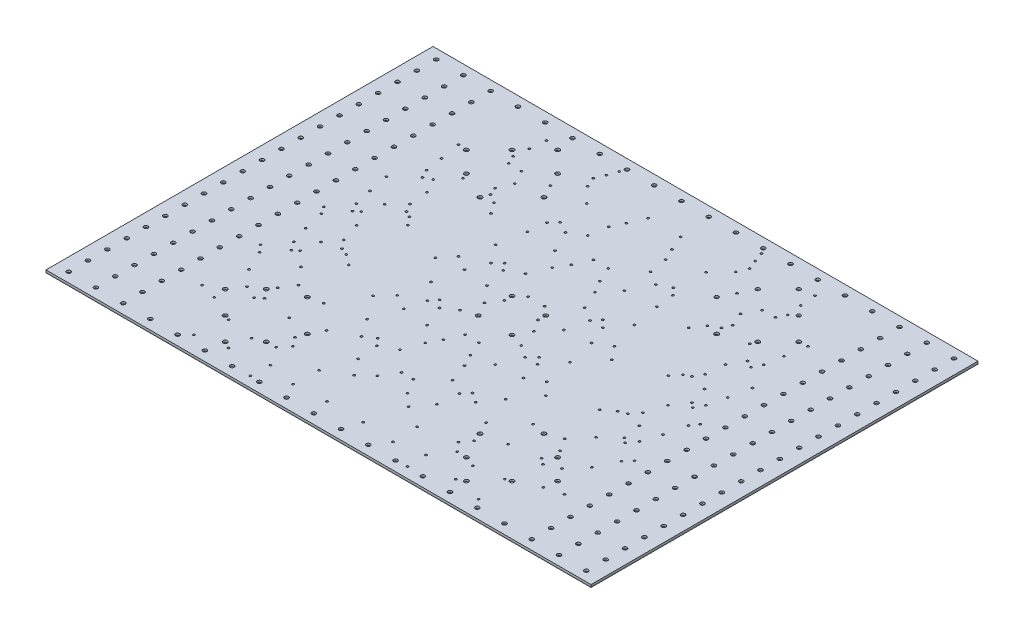
from build123d import *

# Parameters (mm, degrees)
SKETCH2_W                   = 845
SKETCH2_H                   = 600
SKETCH2_R                   = 3.3
SKETCH2_R_2                 = 3.25
SKETCH2_R_3                 = 3
BOSS_EXTRUDE2_DEPTH         = 3
ESQUISSE6_W                 = 845
ESQUISSE6_H                 = 600
ESQUISSE6_R                 = 3.25
BOSS_EXTRU_3_DEPTH          = 1
ESQUISSE5_W                 = 845
ESQUISSE5_H                 = 600
BOSS_EXTRU_2_DEPTH          = 1
ESQUISSE4_R                 = 1.6
ENL_V_MAT_EXTRU_2_DEPTH     = 10
R_P_T_START                 = 1310.548413309
R_P_T_PAR_COURBE2_OUTLINE_R = 1.6
R_P_T_PAR_COURBE2_DEPTH     = 3
SKETCH5_R                   = 3.15
CUT_EXTRUDE1_DEPTH          = 10


# Read off the part's stored shape, not the designer's step: Répét. par courbe2
with BuildPart() as part:
    # Sketch2 → Boss-Extrude2 (new body)
    with BuildSketch(Plane(origin=(0, 1310.548413309, 0), x_dir=(1, 0, 0), z_dir=(0, 1, 0))):
        with Locations((1065.777273447, -1504.227226955)):
            Rectangle(SKETCH2_W, SKETCH2_H)
        with Locations(Location((843.462901442, -1726.54159896, 0), (0, 0, 180))):
            Circle(SKETCH2_R, mode=Mode.SUBTRACT)
        with Locations(Location((878.818240502, -1761.896938019, 0), (0, 0, 180))):
            Circle(SKETCH2_R, mode=Mode.SUBTRACT)
        with Locations(Location((910.638045655, -1730.077132866, 0), (0, 0, 180))):
            Circle(SKETCH2_R, mode=Mode.SUBTRACT)
        with Locations(Location((808.107562383, -1691.186259901, 0), (0, 0, 180))):
            Circle(SKETCH2_R, mode=Mode.SUBTRACT)
        with Locations(Location((839.927367536, -1659.366454747, 0), (0, 0, 180))):
            Circle(SKETCH2_R, mode=Mode.SUBTRACT)
        with Locations(Location((931.851249091, -1687.650725995, 0), (0, 0, 180))):
            Circle(SKETCH2_R, mode=Mode.SUBTRACT)
        with Locations(Location((882.353774408, -1638.153251312, 0), (0, 0, 180))):
            Circle(SKETCH2_R, mode=Mode.SUBTRACT)
        with Locations(Location((1039.614322544, -1530.390177859, 0), (0, 0, 180))):
            Circle(SKETCH2_R_2, mode=Mode.SUBTRACT)
        with Locations(Location((1252.736306393, -1761.896938019, 0), (0, 0, 180))):
            Circle(SKETCH2_R, mode=Mode.SUBTRACT)
        with Locations(Location((1220.91650124, -1730.077132866, 0), (0, 0, 180))):
            Circle(SKETCH2_R, mode=Mode.SUBTRACT)
        with Locations(Location((1288.091645453, -1726.54159896, 0), (0, 0, 180))):
            Circle(SKETCH2_R, mode=Mode.SUBTRACT)
        with Locations(Location((1199.703297804, -1687.650725995, 0), (0, 0, 180))):
            Circle(SKETCH2_R, mode=Mode.SUBTRACT)
        with Locations(Location((1249.200772487, -1638.153251312, 0), (0, 0, 180))):
            Circle(SKETCH2_R, mode=Mode.SUBTRACT)
        with Locations(Location((1323.446984512, -1691.186259901, 0), (0, 0, 180))):
            Circle(SKETCH2_R, mode=Mode.SUBTRACT)
        with Locations(Location((1291.627179358, -1659.366454747, 0), (0, 0, 180))):
            Circle(SKETCH2_R, mode=Mode.SUBTRACT)
        with Locations(Location((1091.940224351, -1530.390177859, 0), (0, 0, 180))):
            Circle(SKETCH2_R_2, mode=Mode.SUBTRACT)
        with Locations(Location((1039.614322544, -1478.064276051, 0), (0, 0, 180))):
            Circle(SKETCH2_R_2, mode=Mode.SUBTRACT)
        with Locations(Location((839.927367536, -1349.087999163, 0), (0, 0, 180))):
            Circle(SKETCH2_R, mode=Mode.SUBTRACT)
        with Locations(Location((808.107562383, -1317.268194009, 0), (0, 0, 180))):
            Circle(SKETCH2_R, mode=Mode.SUBTRACT)
        with Locations(Location((882.353774408, -1370.301202598, 0), (0, 0, 180))):
            Circle(SKETCH2_R, mode=Mode.SUBTRACT)
        with Locations(Location((931.851249091, -1320.803727915, 0), (0, 0, 180))):
            Circle(SKETCH2_R, mode=Mode.SUBTRACT)
        with Locations(Location((843.462901442, -1281.91285495, 0), (0, 0, 180))):
            Circle(SKETCH2_R, mode=Mode.SUBTRACT)
        with Locations(Location((910.638045655, -1278.377321044, 0), (0, 0, 180))):
            Circle(SKETCH2_R, mode=Mode.SUBTRACT)
        with Locations(Location((878.818240502, -1246.55751589, 0), (0, 0, 180))):
            Circle(SKETCH2_R, mode=Mode.SUBTRACT)
        with Locations(Location((1091.940224351, -1478.064276051, 0), (0, 0, 180))):
            Circle(SKETCH2_R_2, mode=Mode.SUBTRACT)
        with Locations(Location((1249.200772487, -1370.301202598, 0), (0, 0, 180))):
            Circle(SKETCH2_R, mode=Mode.SUBTRACT)
        with Locations(Location((1291.627179359, -1349.087999162, 0), (0, 0, 180))):
            Circle(SKETCH2_R, mode=Mode.SUBTRACT)
        with Locations(Location((1323.446984512, -1317.268194009, 0), (0, 0, 180))):
            Circle(SKETCH2_R, mode=Mode.SUBTRACT)
        with Locations(Location((1220.91650124, -1278.377321044, 0), (0, 0, 180.000000001))):
            Circle(SKETCH2_R_3, mode=Mode.SUBTRACT)
        with Locations(Location((1252.736306393, -1246.55751589, 0), (0, 0, 180.000000001))):
            Circle(SKETCH2_R_3, mode=Mode.SUBTRACT)
        with Locations(Location((1288.091645453, -1281.91285495, 0), (0, 0, 180.000000001))):
            Circle(SKETCH2_R_3, mode=Mode.SUBTRACT)
        with Locations(Location((1199.703297804, -1320.803727915, 0), (0, 0, 180.000000001))):
            Circle(SKETCH2_R_3, mode=Mode.SUBTRACT)
    extrude(amount=BOSS_EXTRUDE2_DEPTH)

    # Esquisse4 → Enlèv. mat.-Extru.2 (cut)
    with BuildSketch(Plane(origin=(0, 1313.548413309, 0), x_dir=(1, 0, 0), z_dir=(0, 1, 0))):
        with Locations(Location((773.984163667, -1504.236041092, 0), (0, 0, 180))):
            Circle(ESQUISSE4_R)
    enl_v_mat_extru_2 = extrude(amount=-ENL_V_MAT_EXTRU_2_DEPTH, mode=Mode.SUBTRACT)

    # Répét. par courbe2 outline → Répét. par courbe2 (cut)
    with BuildSketch(Plane(origin=(0, 0, 0), x_dir=(1, 0, 0), z_dir=(0, 1, 0)).offset(R_P_T_START)):
        with Locations((1017.011835586, -1338.058263909)):
            Circle(R_P_T_PAR_COURBE2_OUTLINE_R)
        with Locations((1019.988290397, -1437.531154838)):
            Circle(R_P_T_PAR_COURBE2_OUTLINE_R)
        with Locations((1018.230755151, -1537.324923481)):
            Circle(R_P_T_PAR_COURBE2_OUTLINE_R)
        with Locations((1024.979290951, -1636.984700597)):
            Circle(R_P_T_PAR_COURBE2_OUTLINE_R)
        with Locations((989.799049704, -1727.342884034)):
            Circle(R_P_T_PAR_COURBE2_OUTLINE_R)
        with Locations((894.281195122, -1736.464787711)):
            Circle(R_P_T_PAR_COURBE2_OUTLINE_R)
        with Locations((821.581118835, -1670.932840524)):
            Circle(R_P_T_PAR_COURBE2_OUTLINE_R)
        with Locations((797.757202877, -1574.483875629)):
            Circle(R_P_T_PAR_COURBE2_OUTLINE_R)
        with Locations((794.853703778, -1474.558986203)):
            Circle(R_P_T_PAR_COURBE2_OUTLINE_R)
        with Locations((804.426723908, -1375.197221122)):
            Circle(R_P_T_PAR_COURBE2_OUTLINE_R)
        with Locations((852.841271173, -1289.683714442)):
            Circle(R_P_T_PAR_COURBE2_OUTLINE_R)
        with Locations((944.608883647, -1256.971523567)):
            Circle(R_P_T_PAR_COURBE2_OUTLINE_R)
        with Locations((1021.743712067, -1309.998834826)):
            Circle(R_P_T_PAR_COURBE2_OUTLINE_R)
        with Locations((1032.614618923, -1408.723603574)):
            Circle(R_P_T_PAR_COURBE2_OUTLINE_R)
        with Locations((1027.508784025, -1508.553725652)):
            Circle(R_P_T_PAR_COURBE2_OUTLINE_R)
        with Locations((1035.303345565, -1608.233590697)):
            Circle(R_P_T_PAR_COURBE2_OUTLINE_R)
        with Locations((814.395622483, -1581.338432932)):
            Circle(R_P_T_PAR_COURBE2_OUTLINE_R)
        with Locations((809.302465667, -1481.578071046)):
            Circle(R_P_T_PAR_COURBE2_OUTLINE_R)
        with Locations((822.024260202, -1382.72681922)):
            Circle(R_P_T_PAR_COURBE2_OUTLINE_R)
        with Locations((879.120373848, -1303.087734006)):
            Circle(R_P_T_PAR_COURBE2_OUTLINE_R)
        with Locations((973.344082806, -1295.830867584)):
            Circle(R_P_T_PAR_COURBE2_OUTLINE_R)
        with Locations((1011.998568594, -1383.697051441)):
            Circle(R_P_T_PAR_COURBE2_OUTLINE_R)
        with Locations((1006.141897741, -1483.463134836)):
            Circle(R_P_T_PAR_COURBE2_OUTLINE_R)
        with Locations((1012.901556622, -1583.106166187)):
            Circle(R_P_T_PAR_COURBE2_OUTLINE_R)
        with Locations((1004.784000485, -1681.799044288)):
            Circle(R_P_T_PAR_COURBE2_OUTLINE_R)
        with Locations((925.468262807, -1729.49586717)):
            Circle(R_P_T_PAR_COURBE2_OUTLINE_R)
        with Locations((841.836875587, -1680.088010796)):
            Circle(R_P_T_PAR_COURBE2_OUTLINE_R)
        with Locations((807.111279812, -1587.543060907)):
            Circle(R_P_T_PAR_COURBE2_OUTLINE_R)
        with Locations((801.975144401, -1487.757119695)):
            Circle(R_P_T_PAR_COURBE2_OUTLINE_R)
        with Locations((810.981349638, -1388.363564499)):
            Circle(R_P_T_PAR_COURBE2_OUTLINE_R)
        with Locations((859.004537327, -1302.509952379)):
            Circle(R_P_T_PAR_COURBE2_OUTLINE_R)
        with Locations((950.857781948, -1272.167321043)):
            Circle(R_P_T_PAR_COURBE2_OUTLINE_R)
        with Locations((810.598688291, -1710.723536429)):
            Circle(R_P_T_PAR_COURBE2_OUTLINE_R)
        with Locations((785.185497652, -1615.020632353)):
            Circle(R_P_T_PAR_COURBE2_OUTLINE_R)
        with Locations((781.192989955, -1515.127014876)):
            Circle(R_P_T_PAR_COURBE2_OUTLINE_R)
        with Locations((781.953560087, -1415.139573728)):
            Circle(R_P_T_PAR_COURBE2_OUTLINE_R)
        with Locations((794.853478653, -1316.22906532)):
            Circle(R_P_T_PAR_COURBE2_OUTLINE_R)
        with Locations((857.617508341, -1242.556325342)):
            Circle(R_P_T_PAR_COURBE2_OUTLINE_R)
        with Locations((955.631075645, -1227.683530603)):
            Circle(R_P_T_PAR_COURBE2_OUTLINE_R)
        with Locations((1040.550132416, -1267.963729694)):
            Circle(R_P_T_PAR_COURBE2_OUTLINE_R)
        with Locations((1054.265603444, -1366.399174999)):
            Circle(R_P_T_PAR_COURBE2_OUTLINE_R)
        with Locations((1052.939564152, -1466.378969333)):
            Circle(R_P_T_PAR_COURBE2_OUTLINE_R)
        with Locations((1055.112245474, -1566.324695173)):
            Circle(R_P_T_PAR_COURBE2_OUTLINE_R)
        with Locations((1056.685505477, -1666.290823961)):
            Circle(R_P_T_PAR_COURBE2_OUTLINE_R)
        with Locations((1037.857774403, -1762.990057959)):
            Circle(R_P_T_PAR_COURBE2_OUTLINE_R)
        with Locations((944.02016535, -1787.965350892)):
            Circle(R_P_T_PAR_COURBE2_OUTLINE_R)
        with Locations((845.108093676, -1776.79469851)):
            Circle(R_P_T_PAR_COURBE2_OUTLINE_R)
        with Locations((784.82453177, -1703.667931565)):
            Circle(R_P_T_PAR_COURBE2_OUTLINE_R)
        with Locations((1023.610923678, -1706.802721256)):
            Circle(R_P_T_PAR_COURBE2_OUTLINE_R)
        with Locations((945.112715244, -1758.143381188)):
            Circle(R_P_T_PAR_COURBE2_OUTLINE_R)
        with Locations((851.708005755, -1729.536350273)):
            Circle(R_P_T_PAR_COURBE2_OUTLINE_R)
        with Locations((800.002811332, -1646.237213175)):
            Circle(R_P_T_PAR_COURBE2_OUTLINE_R)
        with Locations((788.869457058, -1547.043097148)):
            Circle(R_P_T_PAR_COURBE2_OUTLINE_R)
        with Locations((788.426664215, -1447.063544953)):
            Circle(R_P_T_PAR_COURBE2_OUTLINE_R)
        with Locations((800.2918428, -1347.99801813)):
            Circle(R_P_T_PAR_COURBE2_OUTLINE_R)
        with Locations((855.297210637, -1266.91803556)):
            Circle(R_P_T_PAR_COURBE2_OUTLINE_R)
        with Locations((950.398303083, -1242.566233676)):
            Circle(R_P_T_PAR_COURBE2_OUTLINE_R)
        with Locations((1030.445086198, -1291.571759589)):
            Circle(R_P_T_PAR_COURBE2_OUTLINE_R)
        with Locations((1043.690013696, -1390.045794566)):
            Circle(R_P_T_PAR_COURBE2_OUTLINE_R)
        with Locations((1039.638768723, -1489.953732783)):
            Circle(R_P_T_PAR_COURBE2_OUTLINE_R)
        with Locations((1044.899385382, -1589.777518976)):
            Circle(R_P_T_PAR_COURBE2_OUTLINE_R)
        with Locations((1042.452852518, -1689.570425299)):
            Circle(R_P_T_PAR_COURBE2_OUTLINE_R)
        with Locations((988.346812624, -1766.197238313)):
            Circle(R_P_T_PAR_COURBE2_OUTLINE_R)
        with Locations((889.467822476, -1767.619527617)):
            Circle(R_P_T_PAR_COURBE2_OUTLINE_R)
        with Locations((900.4495298, -1366.749845931)):
            Circle(R_P_T_PAR_COURBE2_OUTLINE_R)
        with Locations((853.733608854, -1451.192041433)):
            Circle(R_P_T_PAR_COURBE2_OUTLINE_R)
        with Locations((855.337431356, -1550.812041458)):
            Circle(R_P_T_PAR_COURBE2_OUTLINE_R)
        with Locations((903.470157297, -1633.804696358)):
            Circle(R_P_T_PAR_COURBE2_OUTLINE_R)
        with Locations((949.859825549, -1566.135574545)):
            Circle(R_P_T_PAR_COURBE2_OUTLINE_R)
        with Locations((945.045066257, -1466.311636588)):
            Circle(R_P_T_PAR_COURBE2_OUTLINE_R)
        with Locations((912.442082716, -1383.524697839)):
            Circle(R_P_T_PAR_COURBE2_OUTLINE_R)
        with Locations((863.846616914, -1463.650748481)):
            Circle(R_P_T_PAR_COURBE2_OUTLINE_R)
        with Locations((965.419112376, -1379.946559833)):
            Circle(R_P_T_PAR_COURBE2_OUTLINE_R)
        with Locations((886.741570742, -1358.476062076)):
            Circle(R_P_T_PAR_COURBE2_OUTLINE_R)
        with Locations((844.367807668, -1446.450822434)):
            Circle(R_P_T_PAR_COURBE2_OUTLINE_R)
        with Locations((844.187531863, -1546.171841673)):
            Circle(R_P_T_PAR_COURBE2_OUTLINE_R)
        with BuildLine():
            ThreePointArc((879.436556205, -1636.61057897), (879.630603525, -1636.289293066), (879.859879273, -1635.992120346))
            ThreePointArc((879.859879273, -1635.992120346), (879.611495231, -1636.276213805), (879.436556205, -1636.61057897))
        make_face()
        with Locations((958.255110669, -1621.408896004)):
            Circle(R_P_T_PAR_COURBE2_OUTLINE_R)
        with Locations((958.034929344, -1521.959519157)):
            Circle(R_P_T_PAR_COURBE2_OUTLINE_R)
        with Locations((958.226858296, -1422.0237238)):
            Circle(R_P_T_PAR_COURBE2_OUTLINE_R)
        with Locations((871.308795234, -1562.84337327)):
            Circle(R_P_T_PAR_COURBE2_OUTLINE_R)
        with Locations((931.797713653, -1585.557591683)):
            Circle(R_P_T_PAR_COURBE2_OUTLINE_R)
        with Locations((929.032852504, -1486.220508039)):
            Circle(R_P_T_PAR_COURBE2_OUTLINE_R)
        with Locations((977.999717441, -1341.878982234)):
            Circle(R_P_T_PAR_COURBE2_OUTLINE_R)
        with Locations((989.64771797, -1439.558545258)):
            Circle(R_P_T_PAR_COURBE2_OUTLINE_R)
        with Locations((988.715775182, -1539.359671199)):
            Circle(R_P_T_PAR_COURBE2_OUTLINE_R)
        with Locations((992.319282029, -1638.961597282)):
            Circle(R_P_T_PAR_COURBE2_OUTLINE_R)
        with Locations((926.991988655, -1701.80135372)):
            Circle(R_P_T_PAR_COURBE2_OUTLINE_R)
        with Locations((846.860795363, -1648.670442722)):
            Circle(R_P_T_PAR_COURBE2_OUTLINE_R)
        with Locations((819.017650077, -1553.57986759)):
            Circle(R_P_T_PAR_COURBE2_OUTLINE_R)
        with Locations((817.860016543, -1453.679663748)):
            Circle(R_P_T_PAR_COURBE2_OUTLINE_R)
        with Locations((843.447282654, -1357.841122667)):
            Circle(R_P_T_PAR_COURBE2_OUTLINE_R)
        with Locations((921.04382105, -1300.042759721)):
            Circle(R_P_T_PAR_COURBE2_OUTLINE_R)
        with Locations((995.791450252, -1351.18063864)):
            Circle(R_P_T_PAR_COURBE2_OUTLINE_R)
        with Locations((998.507160683, -1450.470487667)):
            Circle(R_P_T_PAR_COURBE2_OUTLINE_R)
        with Locations((999.428733237, -1550.222518311)):
            Circle(R_P_T_PAR_COURBE2_OUTLINE_R)
        with Locations((1001.717454488, -1649.759854072)):
            Circle(R_P_T_PAR_COURBE2_OUTLINE_R)
        with Locations((937.257527464, -1715.613621341)):
            Circle(R_P_T_PAR_COURBE2_OUTLINE_R)
        with Locations((850.976020801, -1673.069622668)):
            Circle(R_P_T_PAR_COURBE2_OUTLINE_R)
        with Locations((968.216032999, -1352.297569762)):
            Circle(R_P_T_PAR_COURBE2_OUTLINE_R)
        with Locations((881.642461856, -1346.298744474)):
            Circle(R_P_T_PAR_COURBE2_OUTLINE_R)
        with Locations((837.04383309, -1433.524785036)):
            Circle(R_P_T_PAR_COURBE2_OUTLINE_R)
        with Locations((833.813384229, -1533.240953824)):
            Circle(R_P_T_PAR_COURBE2_OUTLINE_R)
        with Locations((859.467655991, -1628.919825688)):
            Circle(R_P_T_PAR_COURBE2_OUTLINE_R)
        with Locations((942.086431257, -1668.057670392)):
            Circle(R_P_T_PAR_COURBE2_OUTLINE_R)
        with Locations((972.999353777, -1579.200759307)):
            Circle(R_P_T_PAR_COURBE2_OUTLINE_R)
        with Locations((967.323408138, -1479.438718706)):
            Circle(R_P_T_PAR_COURBE2_OUTLINE_R)
        with Locations((978.979395177, -1450.07296305)):
            Circle(R_P_T_PAR_COURBE2_OUTLINE_R)
        with Locations((980.29237341, -1549.872077298)):
            Circle(R_P_T_PAR_COURBE2_OUTLINE_R)
        with Locations((977.309354601, -1648.931439226)):
            Circle(R_P_T_PAR_COURBE2_OUTLINE_R)
        with Locations((896.063318473, -1679.875414287)):
            Circle(R_P_T_PAR_COURBE2_OUTLINE_R)
        with Locations((836.94063843, -1602.581287182)):
            Circle(R_P_T_PAR_COURBE2_OUTLINE_R)
        with Locations((824.371301329, -1503.719019098)):
            Circle(R_P_T_PAR_COURBE2_OUTLINE_R)
        with Locations((834.44237926, -1404.58521588)):
            Circle(R_P_T_PAR_COURBE2_OUTLINE_R)
        with Locations((890.793704064, -1324.859046506)):
            Circle(R_P_T_PAR_COURBE2_OUTLINE_R)
        with Locations((775.789929839, -1604.217774256)):
            Circle(R_P_T_PAR_COURBE2_OUTLINE_R)
    r_p_t_par_courbe2 = extrude(amount=R_P_T_PAR_COURBE2_DEPTH, mode=Mode.SUBTRACT)

    # Symétrie1: Enlèv. mat.-Extru.2, Répét. par courbe2 across plane
    add(enl_v_mat_extru_2.mirror(Plane.ZY.offset(-1065.777273447)), mode=Mode.SUBTRACT)
    add(r_p_t_par_courbe2.mirror(Plane.ZY.offset(-1065.777273447)), mode=Mode.SUBTRACT)

    # Sketch5 → Cut-Extrude1 (cut)
    with BuildSketch(Plane.XZ.offset(-1310.548413309)):
        with Locations((663.277273447, 1789.227226955)):
            Circle(SKETCH5_R)
        with Locations((663.277273447, 1759.227226955)):
            Circle(SKETCH5_R)
        with Locations((705.527273447, 1759.227226955)):
            Circle(SKETCH5_R)
        with Locations((747.777273447, 1759.227226955)):
            Circle(SKETCH5_R)
        with Locations((1381.527273447, 1759.227226955)):
            Circle(SKETCH5_R)
        with Locations((1423.777273447, 1759.227226955)):
            Circle(SKETCH5_R)
        with Locations((1466.027273447, 1759.227226955)):
            Circle(SKETCH5_R)
        with Locations((663.277273447, 1729.227226955)):
            Circle(SKETCH5_R)
        with Locations((705.527273447, 1729.227226955)):
            Circle(SKETCH5_R)
        with Locations((705.527273447, 1789.227226955)):
            Circle(SKETCH5_R)
        with Locations((747.777273447, 1789.227226955)):
            Circle(SKETCH5_R)
        with Locations((790.027273447, 1789.227226955)):
            Circle(SKETCH5_R)
        with Locations((832.277273447, 1789.227226955)):
            Circle(SKETCH5_R)
        with Locations((874.527273447, 1789.227226955)):
            Circle(SKETCH5_R)
        with Locations((916.777273447, 1789.227226955)):
            Circle(SKETCH5_R)
        with Locations((959.027273447, 1789.227226955)):
            Circle(SKETCH5_R)
        with Locations((1001.277273447, 1789.227226955)):
            Circle(SKETCH5_R)
        with Locations((1043.527273447, 1789.227226955)):
            Circle(SKETCH5_R)
        with Locations((1085.777273447, 1789.227226955)):
            Circle(SKETCH5_R)
        with Locations((1128.027273447, 1789.227226955)):
            Circle(SKETCH5_R)
        with Locations((1170.277273447, 1789.227226955)):
            Circle(SKETCH5_R)
        with Locations((1212.527273447, 1789.227226955)):
            Circle(SKETCH5_R)
        with Locations((1254.777273447, 1789.227226955)):
            Circle(SKETCH5_R)
        with Locations((1297.027273447, 1789.227226955)):
            Circle(SKETCH5_R)
        with Locations((1339.277273447, 1789.227226955)):
            Circle(SKETCH5_R)
        with Locations((1381.527273447, 1789.227226955)):
            Circle(SKETCH5_R)
        with Locations((1423.777273447, 1789.227226955)):
            Circle(SKETCH5_R)
        with Locations((1466.027273447, 1789.227226955)):
            Circle(SKETCH5_R)
        with Locations((747.777273447, 1729.227226955)):
            Circle(SKETCH5_R)
        with Locations((1381.527273447, 1729.227226955)):
            Circle(SKETCH5_R)
        with Locations((1423.777273447, 1729.227226955)):
            Circle(SKETCH5_R)
        with Locations((1466.027273447, 1729.227226955)):
            Circle(SKETCH5_R)
        with Locations((663.277273447, 1699.227226955)):
            Circle(SKETCH5_R)
        with Locations((705.527273447, 1699.227226955)):
            Circle(SKETCH5_R)
        with Locations((747.777273447, 1699.227226955)):
            Circle(SKETCH5_R)
        with Locations((1381.527273447, 1699.227226955)):
            Circle(SKETCH5_R)
        with Locations((1423.777273447, 1699.227226955)):
            Circle(SKETCH5_R)
        with Locations((1466.027273447, 1699.227226955)):
            Circle(SKETCH5_R)
        with Locations((663.277273447, 1669.227226955)):
            Circle(SKETCH5_R)
        with Locations((705.527273447, 1669.227226955)):
            Circle(SKETCH5_R)
        with Locations((747.777273447, 1669.227226955)):
            Circle(SKETCH5_R)
        with Locations((1381.527273447, 1669.227226955)):
            Circle(SKETCH5_R)
        with Locations((1423.777273447, 1669.227226955)):
            Circle(SKETCH5_R)
        with Locations((1466.027273447, 1669.227226955)):
            Circle(SKETCH5_R)
        with Locations((663.277273447, 1639.227226955)):
            Circle(SKETCH5_R)
        with Locations((705.527273447, 1639.227226955)):
            Circle(SKETCH5_R)
        with Locations((747.777273447, 1639.227226955)):
            Circle(SKETCH5_R)
        with Locations((1381.527273447, 1639.227226955)):
            Circle(SKETCH5_R)
        with Locations((1423.777273447, 1639.227226955)):
            Circle(SKETCH5_R)
        with Locations((1466.027273447, 1639.227226955)):
            Circle(SKETCH5_R)
        with Locations((663.277273447, 1609.227226955)):
            Circle(SKETCH5_R)
        with Locations((705.527273447, 1609.227226955)):
            Circle(SKETCH5_R)
        with Locations((747.777273447, 1609.227226955)):
            Circle(SKETCH5_R)
        with Locations((1381.527273447, 1609.227226955)):
            Circle(SKETCH5_R)
        with Locations((1423.777273447, 1609.227226955)):
            Circle(SKETCH5_R)
        with Locations((1466.027273447, 1609.227226955)):
            Circle(SKETCH5_R)
        with Locations((663.277273447, 1579.227226955)):
            Circle(SKETCH5_R)
        with Locations((705.527273447, 1579.227226955)):
            Circle(SKETCH5_R)
        with Locations((747.777273447, 1579.227226955)):
            Circle(SKETCH5_R)
        with Locations((1381.527273447, 1579.227226955)):
            Circle(SKETCH5_R)
        with Locations((1423.777273447, 1579.227226955)):
            Circle(SKETCH5_R)
        with Locations((1466.027273447, 1579.227226955)):
            Circle(SKETCH5_R)
        with Locations((663.277273447, 1549.227226955)):
            Circle(SKETCH5_R)
        with Locations((705.527273447, 1549.227226955)):
            Circle(SKETCH5_R)
        with Locations((747.777273447, 1549.227226955)):
            Circle(SKETCH5_R)
        with Locations((1381.527273447, 1549.227226955)):
            Circle(SKETCH5_R)
        with Locations((1423.777273447, 1549.227226955)):
            Circle(SKETCH5_R)
        with Locations((1466.027273447, 1549.227226955)):
            Circle(SKETCH5_R)
        with Locations((663.277273447, 1519.227226955)):
            Circle(SKETCH5_R)
        with Locations((705.527273447, 1519.227226955)):
            Circle(SKETCH5_R)
        with Locations((747.777273447, 1519.227226955)):
            Circle(SKETCH5_R)
        with Locations((1381.527273447, 1519.227226955)):
            Circle(SKETCH5_R)
        with Locations((1423.777273447, 1519.227226955)):
            Circle(SKETCH5_R)
        with Locations((1466.027273447, 1519.227226955)):
            Circle(SKETCH5_R)
    cut_extrude1 = extrude(amount=-CUT_EXTRUDE1_DEPTH, mode=Mode.SUBTRACT)

    # Symétrie2: Cut-Extrude1 across plane
    add(cut_extrude1.mirror(Plane(origin=(0, 0, 1504.227226955), x_dir=(1, 0, 0), z_dir=(0, 0, -1))), mode=Mode.SUBTRACT)


with BuildPart() as body_2:
    # Esquisse6 → Boss.-Extru.3 (new body)
    with BuildSketch(Plane.XZ.offset(-1310.548413309)):
        with Locations((1065.777273447, 1504.227226955)):
            Rectangle(ESQUISSE6_W, ESQUISSE6_H)
        with Locations((1091.940224351, 1530.390177859)):
            Circle(ESQUISSE6_R, mode=Mode.SUBTRACT)
        with Locations((1039.614322544, 1530.390177859)):
            Circle(ESQUISSE6_R, mode=Mode.SUBTRACT)
        with Locations((1039.614322544, 1478.064276051)):
            Circle(ESQUISSE6_R, mode=Mode.SUBTRACT)
        with Locations((1091.940224351, 1478.064276051)):
            Circle(ESQUISSE6_R, mode=Mode.SUBTRACT)
    extrude(amount=BOSS_EXTRU_3_DEPTH)


with BuildPart() as body_3:
    # Esquisse5 → Boss.-Extru.2 (new body)
    with BuildSketch(Plane.XZ.offset(-1310.548413309)):
        with Locations((1065.777273447, 1504.227226955)):
            Rectangle(ESQUISSE5_W, ESQUISSE5_H)
    extrude(amount=BOSS_EXTRU_2_DEPTH)


solid = Compound([part.part, body_2.part, body_3.part])
